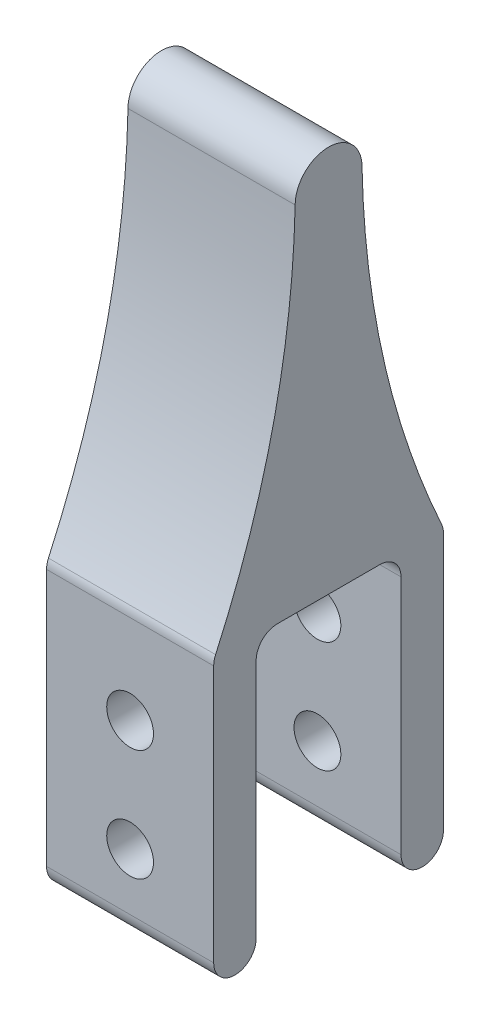
from build123d import *

# Parameters (mm, degrees)
BOSS_EXTRUDE1_DEPTH = 15
SKETCH2_R           = 2.1
CUT_EXTRUDE1_DEPTH  = 66.331515512
FILLET2_R           = 1.905


with BuildPart() as part:
    # Sketch1 → Boss-Extrude1 (new body)
    with BuildSketch(Plane(origin=(0, 0, 0), x_dir=(0, 0, -1), z_dir=(1, 0, 0))):
        with BuildLine():
            Line((-6.5, 0), (-10.31, 0))
            Line((-10.31, 0), (-10.31, 25.4))
            add(Edge.make_bspline(
                [(-10.31, 25.4), (-3.368064257, 40.422360056), (-3, 57.15)],
                knots=[0, 0, 0, 1, 1, 1], degree=2))
            ThreePointArc((-3, 57.15), (0, 60.15), (3, 57.15))
            add(Edge.make_bspline(
                [(10.31, 25.4), (3.368064257, 40.422360056), (3, 57.15)],
                knots=[0, 0, 0, 1, 1, 1], degree=2))
            Line((10.31, 25.4), (10.31, 0))
            Line((10.31, 0), (6.5, 0))
            Line((6.5, 0), (6.5, 25.4))
            Line((6.5, 25.4), (-6.5, 25.4))
            Line((-6.5, 25.4), (-6.5, 0))
        make_face()
    extrude(amount=BOSS_EXTRUDE1_DEPTH)

    # Sketch2 → Cut-Extrude1 (cut, through all)
    with BuildSketch(Plane(origin=(0, 0, -10.31), x_dir=(-1, 0, 0), z_dir=(0, 0, -1))):
        with Locations((-7.5, 7)):
            Circle(SKETCH2_R)
        with Locations((-7.5, 17)):
            Circle(SKETCH2_R)
    extrude(amount=-CUT_EXTRUDE1_DEPTH, mode=Mode.SUBTRACT)

    # Fillet2
    fillet2_edges = [part.edges().sort_by_distance(p)[0] for p in [
        (7.5, 25.4, -10.31),
        (7.5, 0, -10.31),
        (7.5, 0, -6.5),
        (7.5, 0, 6.5),
        (7.5, 0, 10.31),
        (7.5, 25.4, -6.5),
        (7.5, 25.4, 6.5),
        (7.5, 25.4, 10.31),
    ]]
    fillet(fillet2_edges, radius=FILLET2_R - 0.0001)  # a hair under: the kernel refuses the full size


solid = part.part
